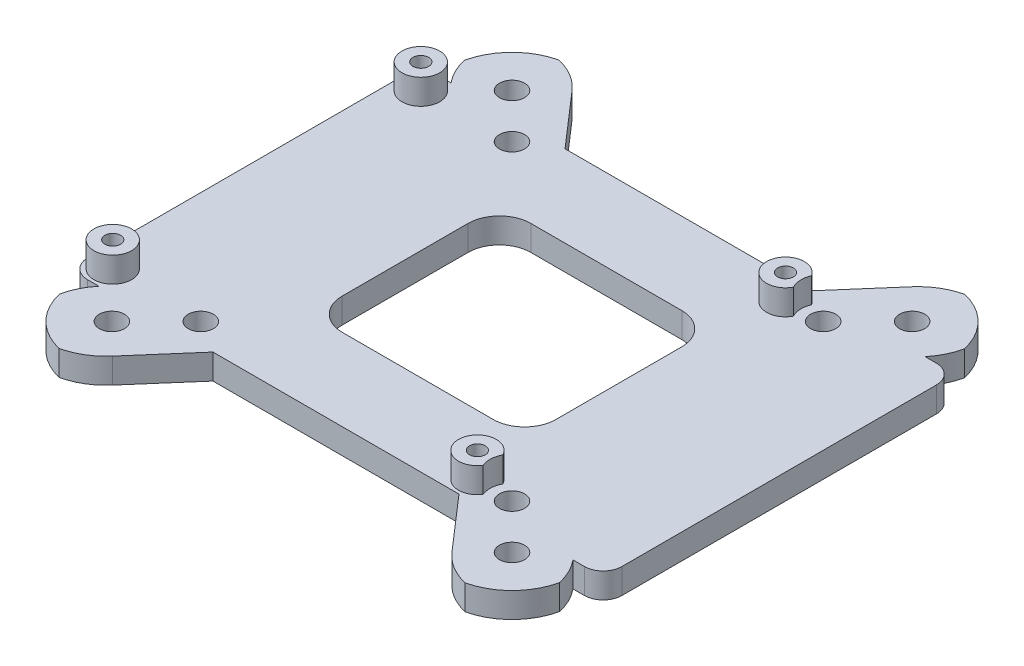
from build123d import *

# Parameters (mm, degrees)
SKETCH1_W           = 85
SKETCH1_H           = 56
SKETCH1_R           = 1.25
BOSS_EXTRUDE1_DEPTH = 4
SKETCH2_R           = 3
SKETCH2_R_2         = 1.25
BOSS_EXTRUDE2_DEPTH = 4
FILLET1_R           = 3
BOSS_EXTRUDE4_DEPTH = 4
SKETCH3_R           = 2
CUT_EXTRUDE1_DEPTH  = 59.5
FILLET2_R           = 10
CUT_EXTRUDE2_START  = -10
SKETCH6_R           = 1.25
CUT_EXTRUDE2_DEPTH  = 10
SKETCH7_R           = 3.5
CUT_EXTRUDE3_DEPTH  = 10


with BuildPart() as part:
    # Sketch1 → Boss-Extrude1 (new body)
    with BuildSketch(Plane(origin=(0, 0, 0), x_dir=(1, 0, 0), z_dir=(0, 1, 0))):
        Rectangle(SKETCH1_W, SKETCH1_H)
        with Locations(Location((-39, 24.5, 0), (0, 0, 270))):
            Circle(SKETCH1_R, mode=Mode.SUBTRACT)
        with Locations(Location((-39, -24.5, 0), (0, 0, 270))):
            Circle(SKETCH1_R, mode=Mode.SUBTRACT)
        with Locations(Location((19, 24.5, 0), (0, 0, 270))):
            Circle(SKETCH1_R, mode=Mode.SUBTRACT)
        with Locations(Location((19, -24.5, 0), (0, 0, 270))):
            Circle(SKETCH1_R, mode=Mode.SUBTRACT)
        with BuildLine():
            Line((-12, -15), (12, -15))
            ThreePointArc((12, -15), (15.535533906, -13.535533906), (17, -10))
            Line((17, -10), (17, 10))
            ThreePointArc((17, 10), (15.535533906, 13.535533906), (12, 15))
            Line((12, 15), (-12, 15))
            ThreePointArc((-12, 15), (-15.535533906, 13.535533906), (-17, 10))
            Line((-17, 10), (-17, -10))
            ThreePointArc((-17, -10), (-15.535533906, -13.535533906), (-12, -15))
        make_face(mode=Mode.SUBTRACT)
    extrude(amount=BOSS_EXTRUDE1_DEPTH)

    # Sketch2 → Boss-Extrude2 (add)
    # profile 1 of 4: a face of its own
    with BuildSketch(Plane(origin=(0, 4, 0), x_dir=(1, 0, 0), z_dir=(0, 1, 0))):
        with Locations(Location((-39, 24.5, 0), (0, 0, 270))):
            Circle(SKETCH2_R)
        with Locations(Location((-39, 24.5, 0), (0, 0, 270))):
            Circle(SKETCH2_R_2, mode=Mode.SUBTRACT)
    # profile 2 of 4: a face of its own
    with BuildSketch(Plane(origin=(0, 4, 0), x_dir=(1, 0, 0), z_dir=(0, 1, 0))):
        with Locations(Location((19, 24.5, 0), (0, 0, 270))):
            Circle(SKETCH2_R)
        with Locations(Location((19, 24.5, 0), (0, 0, 270))):
            Circle(SKETCH2_R_2, mode=Mode.SUBTRACT)
    # profile 3 of 4: a face of its own
    with BuildSketch(Plane(origin=(0, 4, 0), x_dir=(1, 0, 0), z_dir=(0, 1, 0))):
        with Locations(Location((19, -24.5, 0), (0, 0, 270))):
            Circle(SKETCH2_R)
        with Locations(Location((19, -24.5, 0), (0, 0, 270))):
            Circle(SKETCH2_R_2, mode=Mode.SUBTRACT)
    # profile 4 of 4: a face of its own
    with BuildSketch(Plane(origin=(0, 4, 0), x_dir=(1, 0, 0), z_dir=(0, 1, 0))):
        with Locations(Location((-39, -24.5, 0), (0, 0, 270))):
            Circle(SKETCH2_R)
        with Locations(Location((-39, -24.5, 0), (0, 0, 270))):
            Circle(SKETCH2_R_2, mode=Mode.SUBTRACT)
    extrude(amount=BOSS_EXTRUDE2_DEPTH)

    # Fillet1
    fillet1_edges = [part.edges().sort_by_distance(p)[0] for p in [
        (-42.5, 2, 28),
        (-42.5, 2, -28),
        (42.5, 2, -28),
        (42.5, 2, 28),
    ]]
    fillet(fillet1_edges, radius=FILLET1_R)

    # Sketch5 → Boss-Extrude4 (add)
    with BuildSketch(Plane(origin=(0, 0, 0), x_dir=(1, 0, 0), z_dir=(0, 1, 0))):
        Polygon((-40, -30), (-17, -10), (-17, 10), (-40, 30), (-40, 40), (-30, 40), (-10, 17), (10, 17), (30, 40), (40, 40), (40, 30), (17, 10), (17, -10), (40, -30), (40, -40), (30, -40), (10, -17), (-10, -17), (-30, -40), (-40, -40), align=None)
    extrude(amount=BOSS_EXTRUDE4_DEPTH)

    # Sketch3 → Cut-Extrude1 (cut, through all)
    with BuildSketch(Plane(origin=(0, 4, 0), x_dir=(1, 0, 0), z_dir=(0, 1, 0))):
        with Locations(Location((-31.819805153, 31.819805153, 0), (0, 0, 270))):
            Circle(SKETCH3_R)
        with Locations(Location((-24.748737342, 24.748737342, 0), (0, 0, 270))):
            Circle(SKETCH3_R)
        with Locations(Location((31.819805153, 31.819805153, 0), (0, 0, 270))):
            Circle(SKETCH3_R)
        with Locations(Location((24.748737342, 24.748737342, 0), (0, 0, 270))):
            Circle(SKETCH3_R)
        with Locations(Location((24.748737342, -24.748737342, 0), (0, 0, 270))):
            Circle(SKETCH3_R)
        with Locations(Location((31.819805153, -31.819805153, 0), (0, 0, 270))):
            Circle(SKETCH3_R)
        with Locations(Location((-31.819805153, -31.819805153, 0), (0, 0, 270))):
            Circle(SKETCH3_R)
        with Locations(Location((-24.748737342, -24.748737342, 0), (0, 0, 270))):
            Circle(SKETCH3_R)
        with BuildLine():
            Line((12, -15), (-12, -15))
            ThreePointArc((-12, -15), (-15.535533906, -13.535533906), (-17, -10))
            Line((-17, -10), (-17, 10))
            ThreePointArc((-17, 10), (-15.535533906, 13.535533906), (-12, 15))
            Line((-12, 15), (12, 15))
            ThreePointArc((12, 15), (15.535533906, 13.535533906), (17, 10))
            Line((17, 10), (17, -10))
            ThreePointArc((17, -10), (15.535533906, -13.535533906), (12, -15))
        make_face()
    extrude(amount=-CUT_EXTRUDE1_DEPTH, mode=Mode.SUBTRACT)

    # Fillet2
    # the kernel refuses this fillet: 10 mm, written as the material it takes off along each edge
    with BuildSketch(Plane(origin=(-40, -10.951097141, -30), x_dir=(0.7546055221635131, 0, 0.6561787149247771), z_dir=(0, 1, 0))) as fillet2_piece_1_section:
        with BuildLine():
            CenterArc((4.671704482, 9.8672905), FILLET2_R, 221.009086902, 39.646111147)
            Line((-2.87435074, 3.305503351), (-3.025271844, 3.174267608))
            Line((-3.025271844, 3.174267608), (-0.150921104, -0.131235743))
            Line((-0.150921104, -0.131235743), (0, -0.2))
            ThreePointArc((0, -0.2), (1.523975065, -0.2), (3.015475044, -0.19734581))
            Line((3.015475044, -0.19734581), (3.047950131, 0))
        make_face()
    fillet2_piece_1 = extrude(amount=25.902194282, mode=Mode.PRIVATE)
    fillet2_piece_1 = split(fillet2_piece_1, bisect_by=Plane(origin=(-39.506364614, 2, -28), z_dir=(0, 0, -1)), keep=Keep.TOP, mode=Mode.PRIVATE)
    add(fillet2_piece_1, mode=Mode.SUBTRACT)
    with BuildSketch(Plane(origin=(-40, -25, -40), x_dir=(0, 0, 1), z_dir=(0, 1, 0)), Plane(origin=(40, -25, -40), x_dir=(-1, 0, 0), z_dir=(0, 1, 0))) as fillet2_piece_2:
        with BuildLine():
            CenterArc((FILLET2_R, FILLET2_R), FILLET2_R, 180, 90)
            Line((0, FILLET2_R), (-FILLET2_R * 0.02, FILLET2_R))
            Line((-FILLET2_R * 0.02, FILLET2_R), (-FILLET2_R * 0.02, -FILLET2_R * 0.02))
            Line((-FILLET2_R * 0.02, -FILLET2_R * 0.02), (FILLET2_R, -FILLET2_R * 0.02))
            Line((FILLET2_R, -FILLET2_R * 0.02), (FILLET2_R, 0))
        make_face()
    extrude(amount=54, mode=Mode.SUBTRACT)
    with BuildSketch(Plane(origin=(-30, -11.390762292, -40), x_dir=(-1, 0, 0), z_dir=(0, 1, 0)), Plane(origin=(30, -11.390762292, -40), x_dir=(-0.6561787149247741, 0, 0.7546055221635154), z_dir=(0, 1, 0))) as fillet2_piece_3:
        with BuildLine():
            CenterArc((FILLET2_R * 0.455630491663, FILLET2_R), FILLET2_R, 221.009086902, 48.990913098)
            Line((-FILLET2_R * 0.2989750305, FILLET2_R * 0.343821285075), (-FILLET2_R * 0.314067140943, FILLET2_R * 0.330697710777))
            Line((-FILLET2_R * 0.314067140943, FILLET2_R * 0.330697710777), (-FILLET2_R * 0.00911260983327, -FILLET2_R * 0.02))
            Line((-FILLET2_R * 0.00911260983327, -FILLET2_R * 0.02), (FILLET2_R * 0.455630491663, -FILLET2_R * 0.02))
            Line((FILLET2_R * 0.455630491663, -FILLET2_R * 0.02), (FILLET2_R * 0.455630491663, 0))
        make_face()
    extrude(amount=26.781524583, mode=Mode.SUBTRACT)
    with BuildSketch(Plane(origin=(40, -10.951097141, -30), x_dir=(0, 0, -1), z_dir=(0, 1, 0))) as fillet2_piece_4_section:
        with BuildLine():
            CenterArc((4.380438856, 10), FILLET2_R, 230.353888853, 39.646111147)
            Line((-2, 2.3), (-2.127608777, 2.146))
            ThreePointArc((-2.127608777, 2.146), (-1.150921104, 1.018764257), (-0.150921104, -0.131235743))
            Line((-0.150921104, -0.131235743), (0, -0.2))
            Line((0, -0.2), (4.380438856, -0.2))
            Line((4.380438856, -0.2), (4.380438856, 0))
        make_face()
    fillet2_piece_4 = extrude(amount=25.902194282, mode=Mode.PRIVATE)
    fillet2_piece_4 = split(fillet2_piece_4, bisect_by=Plane(origin=(39.506364614, 2, -28), z_dir=(0, 0, -1)), keep=Keep.TOP, mode=Mode.PRIVATE)
    add(fillet2_piece_4, mode=Mode.SUBTRACT)
    with BuildSketch(Plane(origin=(40, -10.951097141, 30), x_dir=(0, 0, 1), z_dir=(0, 1, 0))) as fillet2_piece_5_section:
        with BuildLine():
            CenterArc((4.380438856, -10), FILLET2_R, 90, 39.646111147)
            Line((-2, -2.3), (-2.127608777, -2.146))
            ThreePointArc((-2.127608777, -2.146), (-1.150921104, -1.018764257), (-0.150921104, 0.131235743))
            Line((-0.150921104, 0.131235743), (0, 0.2))
            Line((0, 0.2), (4.380438856, 0.2))
            Line((4.380438856, 0.2), (4.380438856, 0))
        make_face()
    fillet2_piece_5 = extrude(amount=25.902194282, mode=Mode.PRIVATE)
    fillet2_piece_5 = split(fillet2_piece_5, bisect_by=Plane(origin=(39.506364614, 2, 28), z_dir=(0, 0, 1)), keep=Keep.TOP, mode=Mode.PRIVATE)
    add(fillet2_piece_5, mode=Mode.SUBTRACT)
    with BuildSketch(Plane(origin=(40, -25, 40), x_dir=(-1, 0, 0), z_dir=(0, 1, 0)), Plane(origin=(-40, -25, 40), x_dir=(0, 0, -1), z_dir=(0, 1, 0))) as fillet2_piece_6:
        with BuildLine():
            CenterArc((FILLET2_R, -FILLET2_R), FILLET2_R, 90, 90)
            Line((0, -FILLET2_R), (-FILLET2_R * 0.02, -FILLET2_R))
            Line((-FILLET2_R * 0.02, -FILLET2_R), (-FILLET2_R * 0.02, FILLET2_R * 0.02))
            Line((-FILLET2_R * 0.02, FILLET2_R * 0.02), (FILLET2_R, FILLET2_R * 0.02))
            Line((FILLET2_R, FILLET2_R * 0.02), (FILLET2_R, 0))
        make_face()
    extrude(amount=54, mode=Mode.SUBTRACT)
    with BuildSketch(Plane(origin=(30, -11.390762292, 40), x_dir=(-0.6561787149247873, 0, -0.7546055221635042), z_dir=(0, 1, 0)), Plane(origin=(-30, -11.390762292, 40), x_dir=(-1, 0, 0), z_dir=(0, 1, 0))) as fillet2_piece_7:
        with BuildLine():
            CenterArc((FILLET2_R * 0.455630491663, -FILLET2_R), FILLET2_R, 90, 48.990913098)
            Line((-FILLET2_R * 0.2989750305, -FILLET2_R * 0.343821285075), (-FILLET2_R * 0.314067140943, -FILLET2_R * 0.330697710777))
            Line((-FILLET2_R * 0.314067140943, -FILLET2_R * 0.330697710777), (-FILLET2_R * 0.00911260983327, FILLET2_R * 0.02))
            Line((-FILLET2_R * 0.00911260983327, FILLET2_R * 0.02), (FILLET2_R * 0.455630491663, FILLET2_R * 0.02))
            Line((FILLET2_R * 0.455630491663, FILLET2_R * 0.02), (FILLET2_R * 0.455630491663, 0))
        make_face()
    extrude(amount=26.781524583, mode=Mode.SUBTRACT)
    with BuildSketch(Plane(origin=(-40, -10.951097141, 30), x_dir=(0.7546055221635047, 0, -0.6561787149247865), z_dir=(0, 1, 0))) as fillet2_piece_8_section:
        with BuildLine():
            CenterArc((4.671704482, -9.8672905), FILLET2_R, 99.344801951, 39.646111147)
            Line((-2.87435074, -3.305503351), (-3.025271844, -3.174267608))
            Line((-3.025271844, -3.174267608), (-0.150921104, 0.131235743))
            Line((-0.150921104, 0.131235743), (0, 0.2))
            ThreePointArc((0, 0.2), (1.523975065, 0.2), (3.015475044, 0.19734581))
            Line((3.015475044, 0.19734581), (3.047950131, 0))
        make_face()
    fillet2_piece_8 = extrude(amount=25.902194282, mode=Mode.PRIVATE)
    fillet2_piece_8 = split(fillet2_piece_8, bisect_by=Plane(origin=(-39.506364614, 2, 28), z_dir=(0, 0, 1)), keep=Keep.TOP, mode=Mode.PRIVATE)
    add(fillet2_piece_8, mode=Mode.SUBTRACT)

    # Sketch6 → Cut-Extrude2 (cut)
    with BuildSketch(Plane(origin=(0, 4, 0), x_dir=(1, 0, 0), z_dir=(0, 1, 0)).offset(CUT_EXTRUDE2_START)):
        with Locations(Location((19, -24.5, 0), (0, 0, 270))):
            Circle(SKETCH6_R)
        with Locations(Location((19, 24.5, 0), (0, 0, 270))):
            Circle(SKETCH6_R)
    extrude(amount=CUT_EXTRUDE2_DEPTH, mode=Mode.SUBTRACT)

    # Sketch7 → Cut-Extrude3 (cut)
    with BuildSketch(Plane(origin=(0, 4, 0), x_dir=(1, 0, 0), z_dir=(0, 1, 0))):
        with Locations((24.748737342, -24.748737342)):
            Circle(SKETCH7_R)
        with Locations((24.748737342, 24.748737342)):
            Circle(SKETCH7_R)
    extrude(amount=CUT_EXTRUDE3_DEPTH, mode=Mode.SUBTRACT)


solid = part.part
